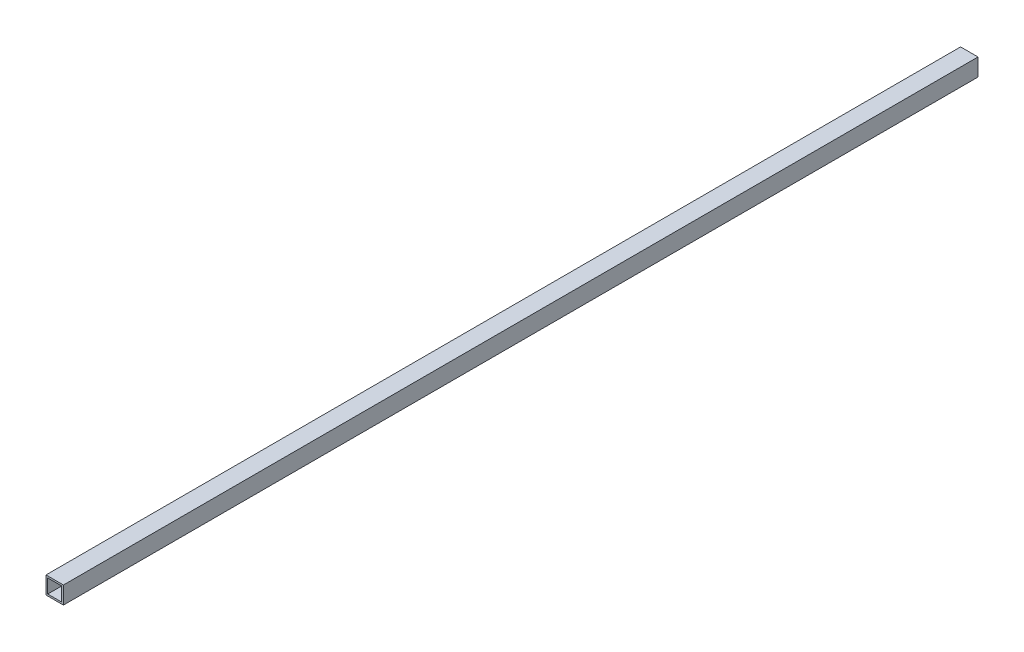
from build123d import *

# Parameters (mm, degrees)
SKETCH1_W           = 19.05
SKETCH1_H           = 19.05
BOSS_EXTRUDE1_DEPTH = 1000.125
SKETCH2_W           = 15.24
SKETCH2_H           = 15.24
CUT_EXTRUDE1_DEPTH  = 1001.487791342


with BuildPart() as part:
    # Sketch1 → Boss-Extrude1 (new body)
    with BuildSketch(Plane.XY):
        with Locations((9.525, 9.525)):
            Rectangle(SKETCH1_W, SKETCH1_H)
    extrude(amount=-BOSS_EXTRUDE1_DEPTH)

    # Sketch2 → Cut-Extrude1 (cut, through all)
    with BuildSketch(Plane.XY):
        with Locations((9.525, 9.525)):
            Rectangle(SKETCH2_W, SKETCH2_H)
    extrude(amount=-CUT_EXTRUDE1_DEPTH, mode=Mode.SUBTRACT)


solid = part.part
